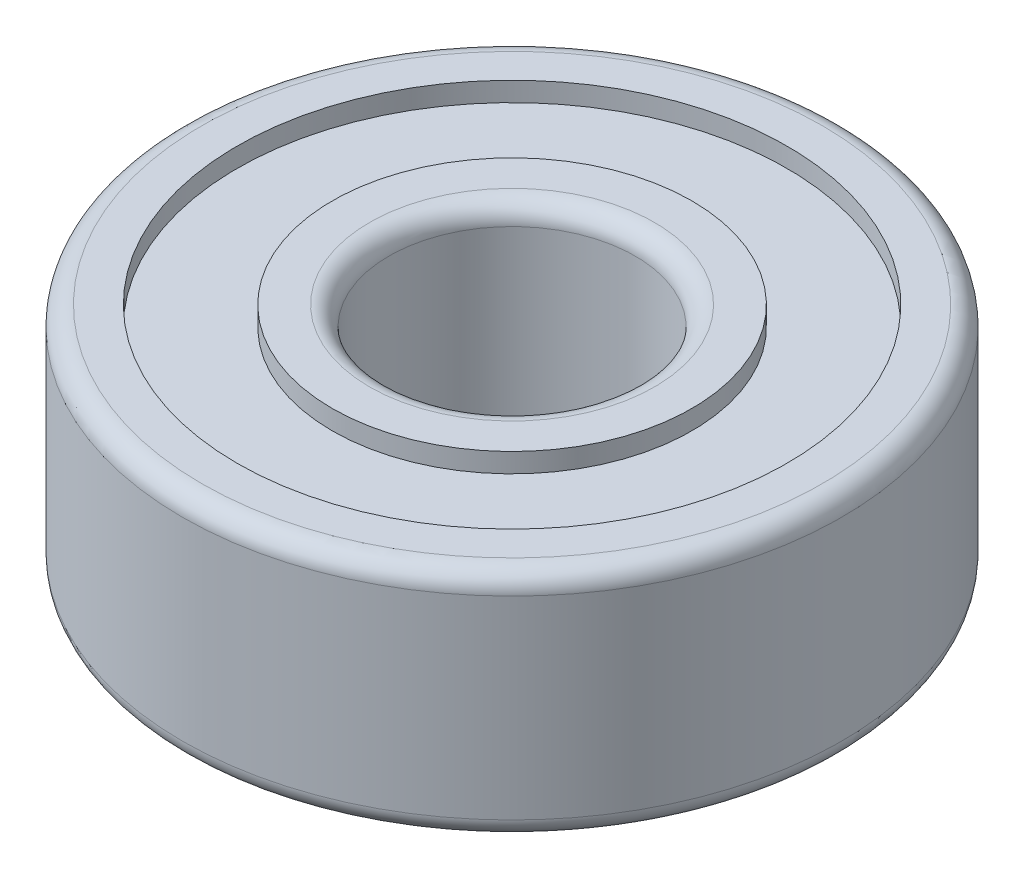
from build123d import *

# Parameters (mm, degrees)
SKETCH1_R           = 17
SKETCH1_R_2         = 6.35
BOSS_EXTRUDE1_DEPTH = 12
FILLET1_R           = 1
SKETCH2_R           = 14.179085796
SKETCH2_R_2         = 9.276544236
CUT_EXTRUDE1_DEPTH  = 1
SKETCH3_R           = 14.472019466
SKETCH3_R_2         = 9.262101897
CUT_EXTRUDE2_DEPTH  = 1


with BuildPart() as part:
    # Sketch1 → Boss-Extrude1 (new body)
    with BuildSketch(Plane(origin=(0, 0, 0), x_dir=(1, 0, 0), z_dir=(0, 1, 0))):
        Circle(SKETCH1_R)
        Circle(SKETCH1_R_2, mode=Mode.SUBTRACT)
    extrude(amount=BOSS_EXTRUDE1_DEPTH)

    # Fillet1
    fillet1_edges = [part.edges().sort_by_distance(p)[0] for p in [
        (-6.35, 0, 0),
        (-6.35, 12, 0),
        (-17, 0, 0),
        (-17, 12, 0),
    ]]
    fillet(fillet1_edges, radius=FILLET1_R)

    # Sketch2 → Cut-Extrude1 (cut)
    with BuildSketch(Plane(origin=(0, 12, 0), x_dir=(1, 0, 0), z_dir=(0, 1, 0))):
        Circle(SKETCH2_R)
        Circle(SKETCH2_R_2, mode=Mode.SUBTRACT)
    extrude(amount=-CUT_EXTRUDE1_DEPTH, mode=Mode.SUBTRACT)

    # Sketch3 → Cut-Extrude2 (cut)
    with BuildSketch(Plane.XZ):
        Circle(SKETCH3_R)
        Circle(SKETCH3_R_2, mode=Mode.SUBTRACT)
    extrude(amount=-CUT_EXTRUDE2_DEPTH, mode=Mode.SUBTRACT)


solid = part.part
